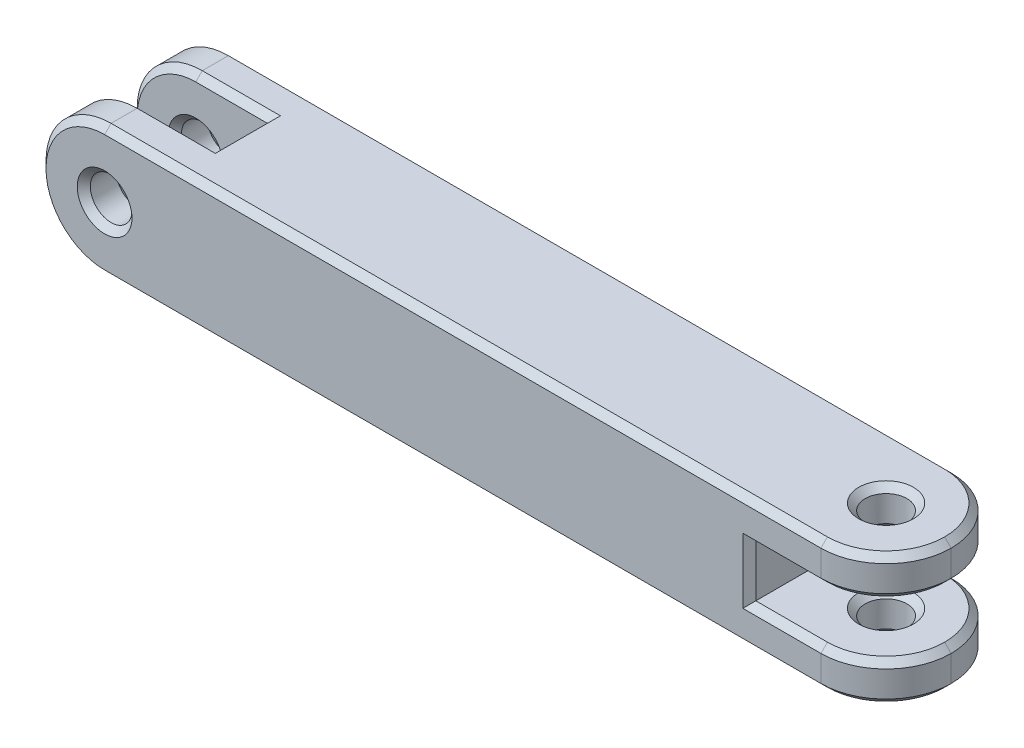
from build123d import *

# Parameters (mm, degrees)
SKETCH1_R               = 1.6
BOSS_EXTRUDE1_DEPTH     = 10
CUT_EXTRUDE1_START      = -7
CUT_EXTRUDE1_DEPTH      = 4
FILLET1_R               = 5
CUT_EXTRUDE2_START      = 49.5
CUT_EXTRUDE2_OUTLINE_W  = 4
CUT_EXTRUDE2_OUTLINE_H  = 10
CUT_EXTRUDE2_DEPTH      = 10.5
CUT_EXTRUDE3_DEPTH      = 62.64414003
CUT_EXTRUDE3_DEPTH_BACK = 62.64414003
SKETCH5_R               = 1.6
CHAMFER1_SIZE           = 0.5


# Read off the part's stored shape, not the designer's step: Cut-Extrude2
with BuildPart() as part:
    # Sketch1 → Boss-Extrude1 (new body)
    with BuildSketch(Plane.XY):
        with BuildLine():
            Line((0, 5), (60, 5))
            Line((60, 5), (60, -5))
            Line((60, -5), (0, -5))
            ThreePointArc((0, -5), (-5, 0), (0, 5))
        make_face()
        Circle(SKETCH1_R, mode=Mode.SUBTRACT)
    extrude(amount=BOSS_EXTRUDE1_DEPTH)

    # Sketch2 → Cut-Extrude1 (cut)
    with BuildSketch(Plane.XY.offset(10).offset(CUT_EXTRUDE1_START)):
        with BuildLine():
            Line((5.5, 5), (5.5, -5))
            Line((5.5, -5), (0, -5))
            ThreePointArc((0, -5), (-5, 0), (0, 5))
            Line((0, 5), (5.5, 5))
        make_face()
    extrude(amount=CUT_EXTRUDE1_DEPTH, mode=Mode.SUBTRACT)

    # Fillet1
    fillet1_edges = [part.edges().sort_by_distance(p)[0] for p in [
        (60, 0, 0),
        (60, 0, 10),
    ]]
    fillet(fillet1_edges, radius=FILLET1_R - 0.0001)  # a hair under: the kernel refuses the full size

    # Cut-Extrude2 outline → Cut-Extrude2 (cut)
    with BuildSketch(Plane.YZ.offset(CUT_EXTRUDE2_START)):
        with Locations((0, 5)):
            Rectangle(CUT_EXTRUDE2_OUTLINE_W, CUT_EXTRUDE2_OUTLINE_H)
    extrude(amount=CUT_EXTRUDE2_DEPTH, mode=Mode.SUBTRACT)

    # Sketch5 → Cut-Extrude3 (cut, two sides: drawn at the far end of the back side and taken through both)
    with BuildSketch(Plane(origin=(0, 5, 0), x_dir=(1, 0, 0), z_dir=(0, 1, 0)).offset(-CUT_EXTRUDE3_DEPTH_BACK)):
        with Locations(Location((55, -5, 0), (0, 0, 270))):
            Circle(SKETCH5_R)
    extrude(amount=CUT_EXTRUDE3_DEPTH + CUT_EXTRUDE3_DEPTH_BACK, mode=Mode.SUBTRACT)

    # Chamfer1
    chamfer1_edges = [part.edges().sort_by_distance(p)[0] for p in [
        (-1.6, 0, 0),
        (-1.6, 0, 10),
        (-1.6, 0, 3),
        (2.75, 5, 3),
        (5.5, 5, 5),
        (2.75, -5, 3),
        (5.5, -5, 5),
        (-5, 0, 3),
        (-1.6, 0, 7),
        (2.75, 5, 7),
        (-5, 0, 7),
        (2.75, -5, 7),
        (27.50005, 5, 10),
        (27.50005, 5, 0),
        (58.535563195, 5, 8.535563195),
        (58.535563195, 5, 1.464436805),
        (58.535563195, -5, 8.535563195),
        (58.535563195, -5, 1.464436805),
        (-5, 0, 10),
        (58.535563195, 2, 1.464436805),
        (58.535563195, -2, 1.464436805),
        (58.535563195, -2, 8.535563195),
        (27.50005, -5, 0),
        (52.25005, -2, 10),
        (49.5, 0, 10),
        (52.25005, -2, 0),
        (49.5, 0, 0),
        (58.535563195, 2, 8.535563195),
        (52.25005, 2, 0),
        (52.25005, 2, 10),
        (-5, 0, 0),
        (55, 2, 3.4),
        (55, 5, 3.4),
        (55, -2, 3.4),
        (55, -5, 3.4),
        (27.50005, -5, 10),
    ]]
    chamfer(chamfer1_edges, length=CHAMFER1_SIZE)


solid = part.part
